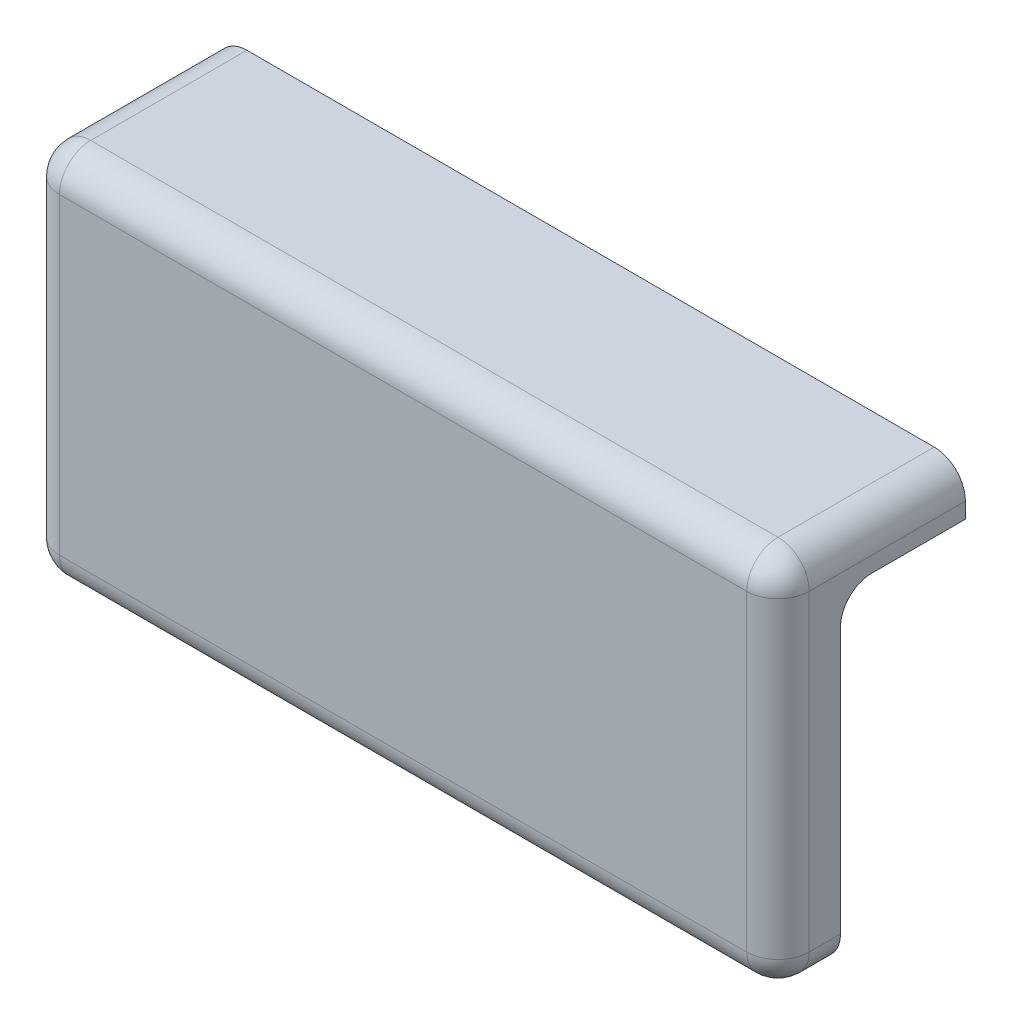
from build123d import *

# Parameters (mm, degrees)
SKETCH1_W             = 19.05
SKETCH1_H             = 38.1
BOSS_EXTRUDE1_DEPTH   = 38.1
SKETCH2_W             = 9.525
SKETCH2_H             = 34.925
CUT_EXTRUDE1_DEPTH    = 12.7
SKETCH3_W             = 28.575
SKETCH3_H             = 33.3375
CUT_EXTRUDE2_DEPTH    = 12.7
FILLET1_R             = 3.175
F_8_CLEARANCE_HOLE1_D = 4.4958
FILLET2_R             = 3.175


with BuildPart() as part:
    # Sketch1 → Boss-Extrude1 (new, symmetric)
    with BuildSketch(Plane(origin=(0, 0, 0), x_dir=(0, 0, -1), z_dir=(1, 0, 0))):
        Rectangle(SKETCH1_W, SKETCH1_H)
    extrude(amount=BOSS_EXTRUDE1_DEPTH, both=True)

    # Sketch2 → Cut-Extrude1 (cut)
    with BuildSketch(Plane(origin=(0, 0, -9.525), x_dir=(-1, 0, 0), z_dir=(0, 0, -1))):
        with Locations((0, -1.5875)):
            Rectangle(SKETCH2_W, SKETCH2_H)
    extrude(amount=-CUT_EXTRUDE1_DEPTH, mode=Mode.SUBTRACT)

    # Sketch3 → Cut-Extrude2 (cut)
    with BuildSketch(Plane(origin=(0, 0, -9.525), x_dir=(-1, 0, 0), z_dir=(0, 0, -1))):
        with Locations((-23.8125, -2.38125)):
            Rectangle(SKETCH3_W, SKETCH3_H)
        with Locations((23.8125, -2.38125)):
            Rectangle(SKETCH3_W, SKETCH3_H)
    extrude(amount=-CUT_EXTRUDE2_DEPTH, mode=Mode.SUBTRACT)

    # Fillet1
    fillet1_edges = [part.edges().sort_by_distance(p)[0] for p in [
        (38.1, 0, 9.525),
        (38.1, -19.05, 6.35),
        (4.7625, 15.875, -3.175),
        (-4.7625, 15.875, -3.175),
        (9.525, 14.2875, -3.175),
        (23.8125, 14.2875, 3.175),
        (9.525, -2.38125, 3.175),
        (-9.525, 14.2875, -3.175),
        (-9.525, -2.38125, 3.175),
        (-23.8125, 14.2875, 3.175),
        (-38.1, -19.05, 6.35),
        (-38.1, 0, 9.525),
        (-38.1, 19.05, 0),
        (38.1, 19.05, 0),
        (0, -19.05, 9.525),
        (0, 19.05, 9.525),
    ]]
    fillet(fillet1_edges, radius=FILLET1_R)

    # #8 Clearance Hole1 (through all)
    with Locations(Plane(origin=(9.525, 0, 0), x_dir=(0, 0, -1), z_dir=(1, 0, 0))):
        with Locations((3.175, -12.7), (3.175, 6.35)):
            Hole(F_8_CLEARANCE_HOLE1_D / 2)

    # Fillet2
    fillet2_edges = [part.edges().sort_by_distance(p)[0] for p in [
        (0, -19.05, 3.175),
    ]]
    fillet(fillet2_edges, radius=FILLET2_R - 0.0001)  # a hair under: the kernel refuses the full size


solid = part.part
